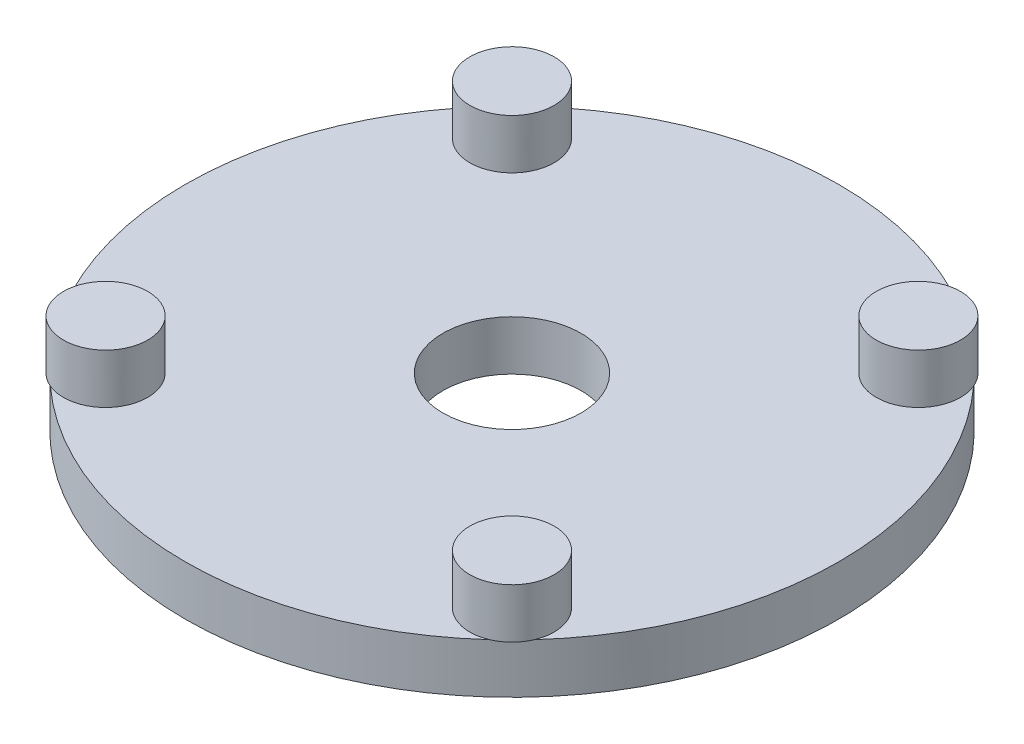
from build123d import *

# Parameters (mm, degrees)
SKETCH1_R           = 29
BOSS_EXTRUDE1_DEPTH = 4.41
SKETCH2_R           = 3.74
BOSS_EXTRUDE2_DEPTH = 4.41
CUT_EXTRUDE1_REACH  = 43.249
SKETCH3_R           = 6.13


with BuildPart() as part:
    # Sketch1 → Boss-Extrude1 (new body)
    with BuildSketch(Plane(origin=(0, 0, 0), x_dir=(1, 0, 0), z_dir=(0, 1, 0))):
        Circle(SKETCH1_R)
    extrude(amount=BOSS_EXTRUDE1_DEPTH)

    # Sketch2 → Boss-Extrude2 (add)
    with BuildSketch(Plane(origin=(0, 4.41, 0), x_dir=(1, 0, 0), z_dir=(0, 1, 0))):
        with Locations((-18.03122292, 18.03122292)):
            Circle(SKETCH2_R)
        with Locations((18.03122292, 18.03122292)):
            Circle(SKETCH2_R)
        with Locations((18.03122292, -18.03122292)):
            Circle(SKETCH2_R)
        with Locations((-18.03122292, -18.03122292)):
            Circle(SKETCH2_R)
    extrude(amount=BOSS_EXTRUDE2_DEPTH)

    # Sketch3 → Cut-Extrude1 (cut, up to next)
    with BuildSketch(Plane(origin=(0, 4.41, 0), x_dir=(1, 0, 0), z_dir=(0, 1, 0)), mode=Mode.PRIVATE) as cut_extrude1_sk1:
        Circle(SKETCH3_R)
    cut_extrude1_tool1 = extrude(cut_extrude1_sk1.sketch, amount=-CUT_EXTRUDE1_REACH, mode=Mode.PRIVATE) & part.part
    add(cut_extrude1_tool1.solids().sort_by_distance((0, 4.41, 0))[0], mode=Mode.SUBTRACT)


solid = part.part
